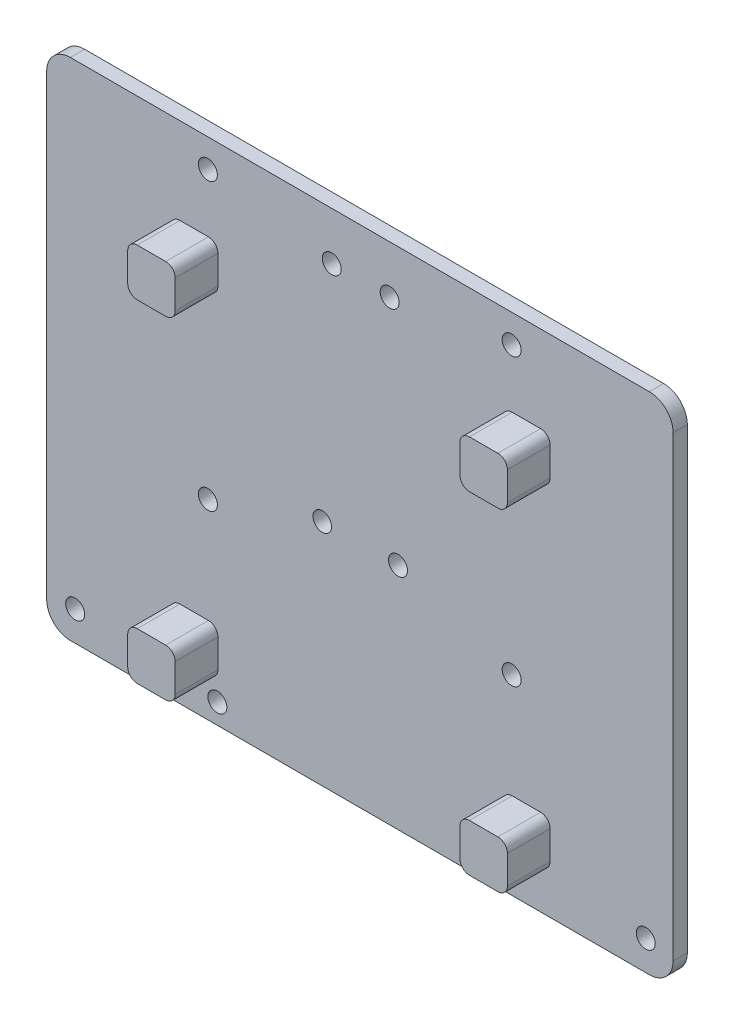
from build123d import *

# Parameters (mm, degrees)
SKETCH1_W           = 66
SKETCH1_H           = 53.2
SKETCH1_R           = 1
SKETCH1_R_2         = 0.98333
SKETCH1_R_3         = 1.011270727
BOSS_EXTRUDE1_DEPTH = 1.5
SKETCH2_W           = 5
SKETCH2_H           = 5
BOSS_EXTRUDE2_DEPTH = 4.5
FILLET1_R           = 1
FILLET2_R           = 2.5


with BuildPart() as part:
    # Sketch1 → Boss-Extrude1 (new body)
    with BuildSketch(Plane.XY.offset(10)):
        with Locations((177.963936399, 293.439054482)):
            Rectangle(SKETCH1_W, SKETCH1_H)
        with Locations((161.947495, 317.06050799)):
            Circle(SKETCH1_R, mode=Mode.SUBTRACT)
        with Locations((193.956452611, 317.06050799)):
            Circle(SKETCH1_R, mode=Mode.SUBTRACT)
        with Locations((174.997800233, 314.982847455)):
            Circle(SKETCH1_R, mode=Mode.SUBTRACT)
        with Locations((181.100928053, 314.982847455)):
            Circle(SKETCH1_R, mode=Mode.SUBTRACT)
        with Locations((173.997800233, 290.965333254)):
            Circle(SKETCH1_R_2, mode=Mode.SUBTRACT)
        with Locations((181.983306885, 290.965333254)):
            Circle(SKETCH1_R, mode=Mode.SUBTRACT)
        with Locations((161.947495, 286.962677261)):
            Circle(SKETCH1_R, mode=Mode.SUBTRACT)
        with Locations((193.956452611, 286.962677261)):
            Circle(SKETCH1_R, mode=Mode.SUBTRACT)
        with Locations((162.947495, 268.970540104)):
            Circle(SKETCH1_R, mode=Mode.SUBTRACT)
        with Locations((192.956452611, 268.970540104)):
            Circle(SKETCH1_R_3, mode=Mode.SUBTRACT)
        with Locations((208.084556857, 269.981810832)):
            Circle(SKETCH1_R, mode=Mode.SUBTRACT)
        with Locations((147.966567684, 269.970540104)):
            Circle(SKETCH1_R, mode=Mode.SUBTRACT)
    extrude(amount=BOSS_EXTRUDE1_DEPTH)

    # Sketch2 → Boss-Extrude2 (add)
    with BuildSketch(Plane.XY.offset(11.5)):
        with Locations((195.50417089, 308.439334712)):
            Rectangle(SKETCH2_W, SKETCH2_H)
        with Locations((160.50417089, 308.439334712)):
            Rectangle(SKETCH2_W, SKETCH2_H)
        with Locations((195.50417089, 273.439334712)):
            Rectangle(SKETCH2_W, SKETCH2_H)
        with Locations((160.50417089, 273.439334712)):
            Rectangle(SKETCH2_W, SKETCH2_H)
    extrude(amount=BOSS_EXTRUDE2_DEPTH)

    # Fillet1
    fillet1_edges = [part.edges().sort_by_distance(p)[0] for p in [
        (158.00417089, 275.939334712, 13.75),
        (163.00417089, 275.939334712, 13.75),
        (163.00417089, 270.939334712, 13.75),
        (158.00417089, 270.939334712, 13.75),
        (198.00417089, 275.939334712, 13.75),
        (193.00417089, 275.939334712, 13.75),
        (198.00417089, 270.939334712, 13.75),
        (193.00417089, 270.939334712, 13.75),
        (193.00417089, 305.939334712, 13.75),
        (193.00417089, 310.939334712, 13.75),
        (198.00417089, 305.939334712, 13.75),
        (198.00417089, 310.939334712, 13.75),
        (158.00417089, 310.939334712, 13.75),
        (163.00417089, 310.939334712, 13.75),
        (163.00417089, 305.939334712, 13.75),
        (158.00417089, 305.939334712, 13.75),
    ]]
    fillet(fillet1_edges, radius=FILLET1_R)

    # Fillet2
    fillet2_edges = [part.edges().sort_by_distance(p)[0] for p in [
        (144.963936399, 320.039054482, 10.75),
        (210.963936399, 320.039054482, 10.75),
        (210.963936399, 266.839054482, 10.75),
        (144.963936399, 266.839054482, 10.75),
    ]]
    fillet(fillet2_edges, radius=FILLET2_R)


solid = part.part
